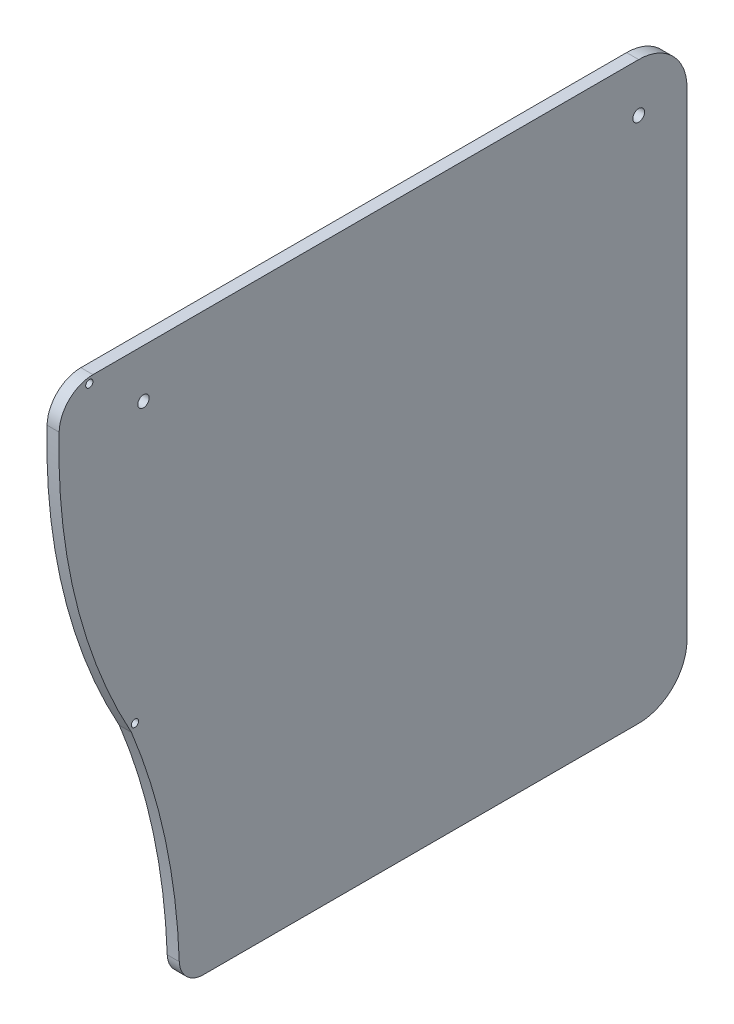
from build123d import *

# Parameters (mm, degrees)
SKETCH1_R           = 1.55
BOSS_EXTRUDE1_DEPTH = 3.175
CUT_EXTRUDE1_DEPTH  = 112.958261642
FILLET1_R           = 8.89
SKETCH3_R           = 1.5
CUT_EXTRUDE2_DEPTH  = 112.958261642
SKETCH4_R           = 0.9525
CUT_EXTRUDE3_DEPTH  = 112.958261642
FILLET2_R           = 6.35


with BuildPart() as part:
    # Sketch1 → Boss-Extrude1 (new body)
    with BuildSketch(Plane(origin=(0, 0, 0), x_dir=(0, 0, -1), z_dir=(1, 0, 0))):
        with BuildLine():
            Line((69.85, 75.565), (-82.55, 75.565))
            Line((-82.55, 75.565), (-82.55, -75.565))
            Line((-82.55, -75.565), (69.85, -75.565))
            ThreePointArc((69.85, -75.565), (78.830256121, -71.845256121), (82.55, -62.865))
            Line((82.55, -62.865), (82.55, 62.865))
            ThreePointArc((82.55, 62.865), (78.830256121, 71.845256121), (69.85, 75.565))
        make_face()
        with Locations((69.85, 62.865)):
            Circle(SKETCH1_R, mode=Mode.SUBTRACT)
    extrude(amount=BOSS_EXTRUDE1_DEPTH)

    # Sketch2 → Cut-Extrude1 (cut, through all)
    with BuildSketch(Plane(origin=(3.175, 0, 0), x_dir=(0, 0, -1), z_dir=(1, 0, 0))):
        with BuildLine():
            ThreePointArc((-50.8, -75.565), (-54.005053677, -42.622362446), (-63.5, -10.915332745))
            ThreePointArc((-63.5, -10.915332745), (-77.710665491, 24.765), (-82.55, 62.865))
            Line((-82.55, 62.865), (-82.55, -75.565))
            Line((-82.55, -75.565), (-50.8, -75.565))
        make_face()
        with BuildLine():
            Line((-82.55, 75.565), (-82.55, 62.865))
            ThreePointArc((-82.55, 62.865), (-82.417420191, 69.220528969), (-82.019911437, 75.565))
            Line((-82.019911437, 75.565), (-82.55, 75.565))
        make_face()
    extrude(amount=-CUT_EXTRUDE1_DEPTH, mode=Mode.SUBTRACT)

    # Fillet1
    fillet1_edges = [part.edges().sort_by_distance(p)[0] for p in [
        (1.5875, 75.565, 82.019911437),
    ]]
    fillet(fillet1_edges, radius=FILLET1_R)

    # Sketch3 → Cut-Extrude2 (cut, through all)
    with BuildSketch(Plane(origin=(3.175, 0, 0), x_dir=(0, 0, -1), z_dir=(1, 0, 0))):
        with Locations((-60.325, 62.865)):
            Circle(SKETCH3_R)
    extrude(amount=-CUT_EXTRUDE2_DEPTH, mode=Mode.SUBTRACT)

    # Sketch4 → Cut-Extrude3 (cut, through all)
    with BuildSketch(Plane(origin=(3.175, 0, 0), x_dir=(0, 0, -1), z_dir=(1, 0, 0))):
        with Locations((-74.561915864, 73.9775)):
            Circle(SKETCH4_R)
        with Locations((-62.57206458, -9.313350112)):
            Circle(SKETCH4_R)
    extrude(amount=-CUT_EXTRUDE3_DEPTH, mode=Mode.SUBTRACT)

    # Fillet2
    fillet2_edges = [part.edges().sort_by_distance(p)[0] for p in [
        (1.5875, -75.565, 50.8),
    ]]
    fillet(fillet2_edges, radius=FILLET2_R)


solid = part.part
